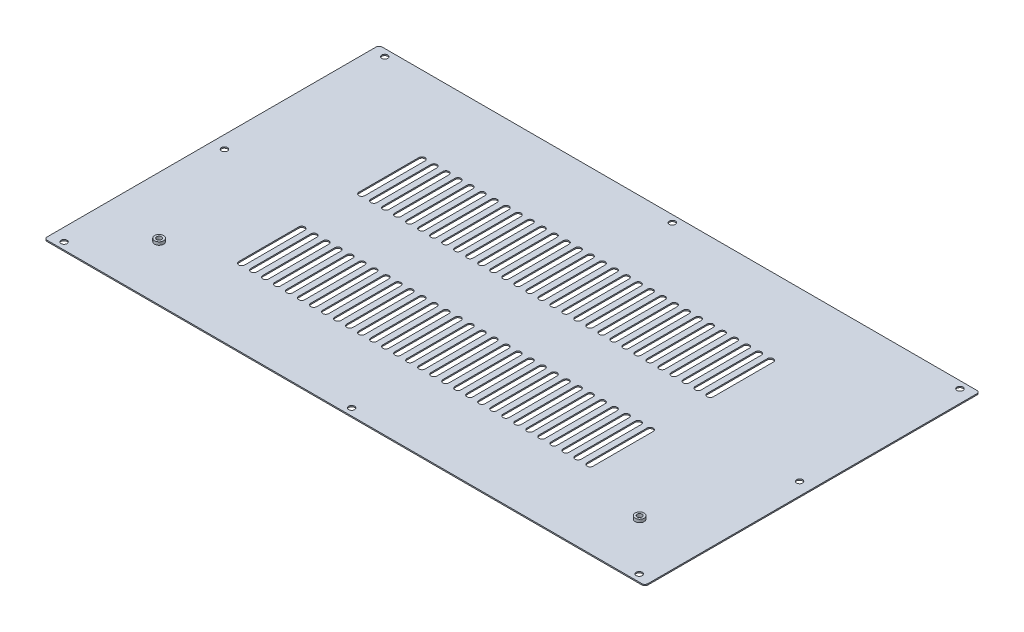
from build123d import *

# Parameters (mm, degrees)
SKETCH_1_W                  = 400
SKETCH_1_H                  = 223
SKETCH_1_R                  = 2
SM_BASE_FLANGE_1_DEPTH      = 0.8
CUT_EXTRUDE_1_DEPTH         = 229.982291892
PATTERN_LINEAR_1_COUNT      = 30
PATTERN_LINEAR_1_PITCH      = 8
PATTERN_LINEAR_1_COUNT_DIR2 = 2
PATTERN_LINEAR_1_PITCH_DIR2 = 80
FILLET_1_R                  = 2
SKETCH_7_R                  = 3
EXTRUDE_1_DEPTH             = 2
HOLE_WIZARD_M4_1_D          = 3.3
HOLE_WIZARD_M4_1_DEPTH      = 11.5
HOLE_WIZARD_M4_1_TIP        = 0.991420021


# Sheet-metal steps are written as plain solids
with BuildPart() as part:
    # Sketch 1 → 基体-法兰1 (new body)
    with BuildSketch(Plane(origin=(0, 0, 0), x_dir=(1, 0, 0), z_dir=(0, 1, 0))):
        Rectangle(SKETCH_1_W, SKETCH_1_H)
        with Locations(Location((-191.5, 106.8, 0), (0, 0, 270))):
            Circle(SKETCH_1_R, mode=Mode.SUBTRACT)
        with Locations(Location((-191.5, -106.8, 0), (0, 0, 270))):
            Circle(SKETCH_1_R, mode=Mode.SUBTRACT)
        with Locations(Location((-191.5, 0, 0), (0, 0, 270))):
            Circle(SKETCH_1_R, mode=Mode.SUBTRACT)
        with Locations(Location((0, -106.8, 0), (0, 0, 270))):
            Circle(SKETCH_1_R, mode=Mode.SUBTRACT)
        with Locations(Location((0, 106.8, 0), (0, 0, 270))):
            Circle(SKETCH_1_R, mode=Mode.SUBTRACT)
        with Locations(Location((191.5, 106.8, 0), (0, 0, 270))):
            Circle(SKETCH_1_R, mode=Mode.SUBTRACT)
        with Locations(Location((191.5, -106.8, 0), (0, 0, 270))):
            Circle(SKETCH_1_R, mode=Mode.SUBTRACT)
        with Locations(Location((191.5, 0, 0), (0, 0, 270))):
            Circle(SKETCH_1_R, mode=Mode.SUBTRACT)
    extrude(amount=-SM_BASE_FLANGE_1_DEPTH)

    # 草图6 → 切除-拉伸1 (cut, through all)
    with BuildSketch(Plane(origin=(0, 0, 0), x_dir=(1, 0, 0), z_dir=(0, 1, 0))):
        with BuildLine():
            Line((-118, 60), (-118, 20))
            ThreePointArc((-118, 20), (-120, 18), (-122, 20))
            Line((-122, 20), (-122, 60))
            ThreePointArc((-122, 60), (-120, 62), (-118, 60))
        make_face()
    cut_extrude_1 = extrude(amount=-CUT_EXTRUDE_1_DEPTH, mode=Mode.SUBTRACT)

    # 阵列(线性)1: Cut-Extrude 1 30 × 2
    with Locations(*[(i * PATTERN_LINEAR_1_PITCH, 0, j * PATTERN_LINEAR_1_PITCH_DIR2) for i in range(PATTERN_LINEAR_1_COUNT) for j in range(PATTERN_LINEAR_1_COUNT_DIR2) if (i, j) != (0, 0)]):
        add(cut_extrude_1, mode=Mode.SUBTRACT)

    # 圆角1
    fillet_1_edges = [part.edges().sort_by_distance(p)[0] for p in [
        (-200, -0.4, -111.5),
        (200, -0.4, -111.5),
        (200, -0.4, 111.5),
        (-200, -0.4, 111.5),
    ]]
    fillet(fillet_1_edges, radius=FILLET_1_R)

    # 草图7 → 凸台-拉伸1 (add)
    with BuildSketch(Plane(origin=(0, 0, 0), x_dir=(1, 0, 0), z_dir=(0, 1, 0))):
        with Locations(Location((-160, -75, 0), (0, 0, 90))):
            Circle(SKETCH_7_R)
        with Locations(Location((160, -75, 0), (0, 0, 90))):
            Circle(SKETCH_7_R)
    extrude(amount=EXTRUDE_1_DEPTH)

    # M4 螺纹孔1
    with Locations(Plane(origin=(0, -0.8, 0), x_dir=(-1, 0, 0), z_dir=(0, -1, 0))):
        with Locations((160, -75), (-160, -75)):
            Hole(HOLE_WIZARD_M4_1_D / 2, depth=HOLE_WIZARD_M4_1_DEPTH)
            with Locations((0, 0, -(HOLE_WIZARD_M4_1_DEPTH + HOLE_WIZARD_M4_1_TIP / 2))):  # 118° drill point
                Cone(0, HOLE_WIZARD_M4_1_D / 2, HOLE_WIZARD_M4_1_TIP, mode=Mode.SUBTRACT)


solid = part.part
